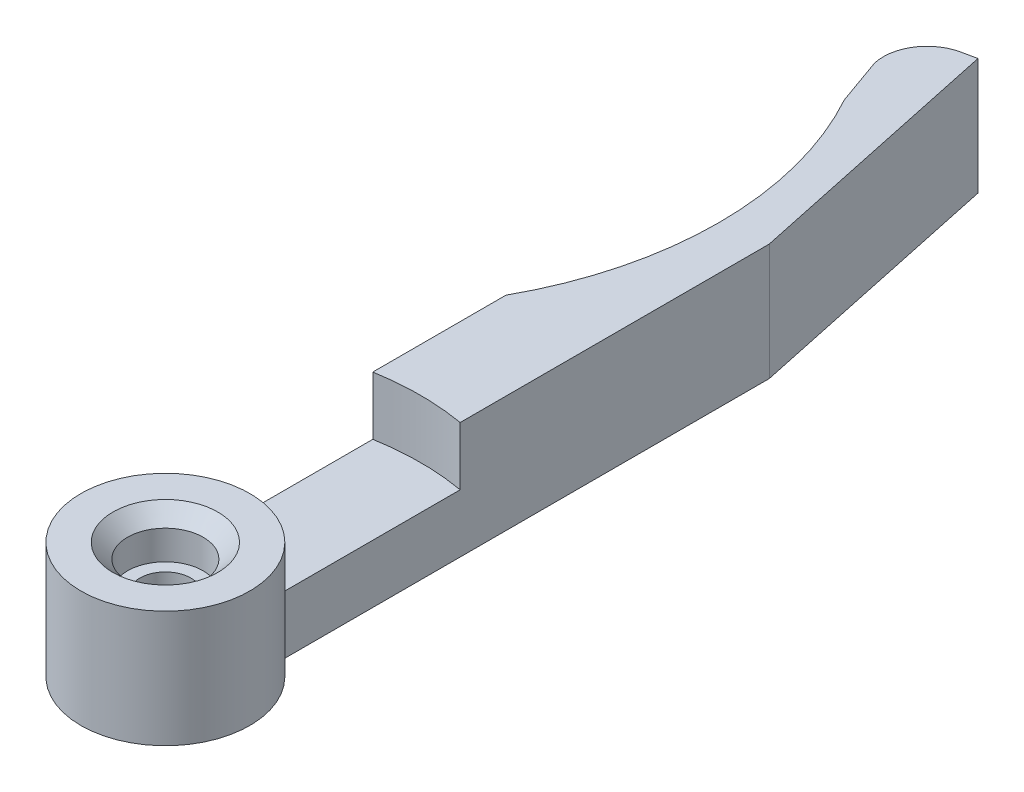
from build123d import *

# Parameters (mm, degrees)
BOSS_EXTRU_1_DEPTH      = 8
ESQUISSE2_R             = 2.6
ENL_V_MAT_EXTRU_1_DEPTH = 3
ENL_V_MAT_EXTRU_2_REACH = 59.173
ESQUISSE3_R             = 1.75
ESQUISSE4_R             = 3.75
ENL_V_MAT_EXTRU_3_DEPTH = 2
ENL_V_START             = -4
ENL_V_MAT_EXTRU_4_DEPTH = 4
CHANFREIN1_SIZE         = 1


with BuildPart() as part:
    # Esquisse1 → Boss.-Extru.1 (new body)
    with BuildSketch(Plane(origin=(0, 0, 0), x_dir=(1, 0, 0), z_dir=(0, 1, 0))):
        with BuildLine():
            Line((-3, 26.381049961), (-3, 4.963869458))
            ThreePointArc((-3, 4.963869458), (0, -5.8), (3, 4.963869458))
            Line((3, 4.963869458), (3, 38.463869458))
            Line((3, 38.463869458), (-0.867157449, 56.657414832))
            Line((-0.867157449, 56.657414832), (-1.84530505, 56.449503141))
            ThreePointArc((-1.84530505, 56.449503141), (-3.756758837, 55.119060789), (-4.140414176, 52.821988519))
            Line((-4.140414176, 52.821988519), (-3, 49.618950039))
            ThreePointArc((-3, 49.618950039), (0, 38), (-3, 26.381049961))
        make_face()
    extrude(amount=BOSS_EXTRU_1_DEPTH)

    # Esquisse2 → Enlèv. mat.-Extru.1 (cut)
    with BuildSketch(Plane(origin=(0, 8, 0), x_dir=(1, 0, 0), z_dir=(0, 1, 0))):
        Circle(ESQUISSE2_R)
    extrude(amount=-ENL_V_MAT_EXTRU_1_DEPTH, mode=Mode.SUBTRACT)

    # Esquisse3 → Enlèv. mat.-Extru.2 (cut, up to next)
    with BuildSketch(Plane(origin=(0, 5, 0), x_dir=(1, 0, 0), z_dir=(0, 1, 0)), mode=Mode.PRIVATE) as enl_v_mat_extru_2_sk1:
        Circle(ESQUISSE3_R)
    enl_v_mat_extru_2_tool1 = extrude(enl_v_mat_extru_2_sk1.sketch, amount=-ENL_V_MAT_EXTRU_2_REACH, mode=Mode.PRIVATE) & part.part
    add(enl_v_mat_extru_2_tool1.solids().sort_by_distance((0, 5, 0))[0], mode=Mode.SUBTRACT)

    # Esquisse4 → Enlèv. mat.-Extru.3 (cut)
    with BuildSketch(Plane.XZ):
        Circle(ESQUISSE4_R)
    extrude(amount=-ENL_V_MAT_EXTRU_3_DEPTH, mode=Mode.SUBTRACT)

    # Esquisse5 → Enlèv. mat.-Extru.4 (cut)
    with BuildSketch(Plane(origin=(0, 8, 0), x_dir=(1, 0, 0), z_dir=(0, 1, 0)).offset(ENL_V_START)):
        with BuildLine():
            Line((-3, 4.963869458), (-3, 17.24093965))
            ThreePointArc((-3, 17.24093965), (0, 17.5), (3, 17.24093965))
            Line((3, 17.24093965), (3, 4.963869458))
            ThreePointArc((3, 4.963869458), (0, 5.8), (-3, 4.963869458))
        make_face()
    extrude(amount=ENL_V_MAT_EXTRU_4_DEPTH, mode=Mode.SUBTRACT)

    # Chanfrein1
    chanfrein1_edges = [part.edges().sort_by_distance(p)[0] for p in [
        (-2.6, 8, 0),
    ]]
    chamfer(chanfrein1_edges, length=CHANFREIN1_SIZE)


solid = part.part
